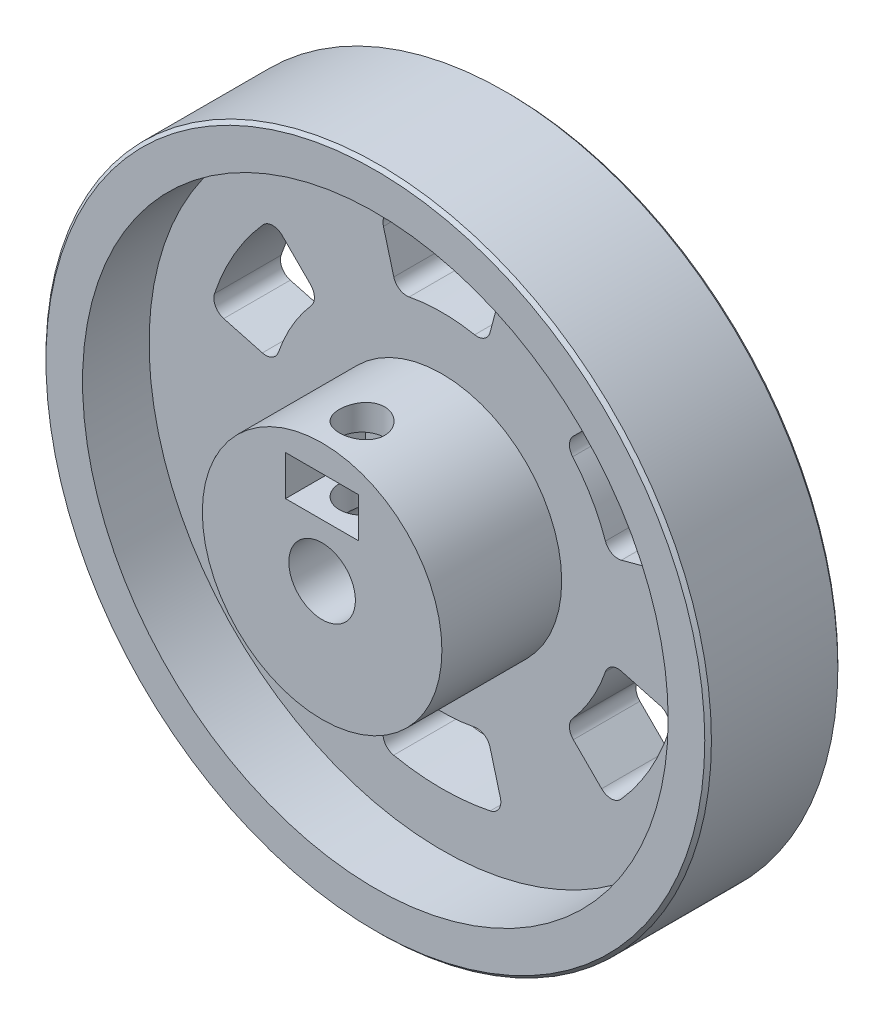
from build123d import *

# Parameters (mm, degrees)
SKETCH1_R               = 25
BOSS_EXTRUDE1_DEPTH     = 5
SKETCH3_R               = 25
SKETCH3_R_2             = 22
BOSS_EXTRUDE3_DEPTH     = 10
SKETCH4_R               = 9
BOSS_EXTRUDE4_DEPTH     = 14
SKETCH5_R               = 2.5
CUT_EXTRUDE1_DEPTH      = 39.026306684
SKETCH6_W               = 5.5
SKETCH6_H               = 3
CUT_EXTRUDE2_DEPTH      = 6
CUT_EXTRUDE3_REACH      = 40.026
CUT_EXTRUDE3_END_RADIUS = 9
SKETCH7_R               = 1.7
CUT_EXTRUDE4_DEPTH      = 39.02630672
CIRPATTERN1_COUNT       = 6
CHAMFER1_SIZE           = 0.25


with BuildPart() as part:
    # Sketch1 → Boss-Extrude1 (new body)
    with BuildSketch(Plane.XY):
        Circle(SKETCH1_R)
    extrude(amount=BOSS_EXTRUDE1_DEPTH)

    # Sketch3 → Boss-Extrude3 (add)
    with BuildSketch(Plane.XY):
        Circle(SKETCH3_R)
        Circle(SKETCH3_R_2, mode=Mode.SUBTRACT)
    extrude(amount=BOSS_EXTRUDE3_DEPTH)

    # Sketch4 → Boss-Extrude4 (add)
    with BuildSketch(Plane.XY):
        Circle(SKETCH4_R)
    extrude(amount=BOSS_EXTRUDE4_DEPTH)

    # Sketch5 → Cut-Extrude1 (cut, through all)
    with BuildSketch(Plane.XY):
        Circle(SKETCH5_R)
    extrude(amount=CUT_EXTRUDE1_DEPTH, mode=Mode.SUBTRACT)

    # Sketch6 → Cut-Extrude2 (cut)
    with BuildSketch(Plane.XY.offset(14)):
        with Locations((0, 5.5)):
            Rectangle(SKETCH6_W, SKETCH6_H)
    extrude(amount=-CUT_EXTRUDE2_DEPTH, mode=Mode.SUBTRACT)

    # Cut-Extrude3: up to this cylinder (the profile starts inside it)
    cut_extrude3_end = Plane(origin=(0, 0, 11), z_dir=(0, 0, -1)) * Cylinder(CUT_EXTRUDE3_END_RADIUS, 99.052, mode=Mode.PRIVATE)
    # Sketch7 → Cut-Extrude3 (cut, up to the surface)
    with BuildSketch(Plane(origin=(0, 0, 0), x_dir=(1, 0, 0), z_dir=(0, 1, 0)), mode=Mode.PRIVATE) as cut_extrude3_sk1:
        with Locations((0, -11)):
            Circle(SKETCH7_R)
    cut_extrude3_tool1 = extrude(cut_extrude3_sk1.sketch, amount=CUT_EXTRUDE3_REACH, mode=Mode.PRIVATE) & cut_extrude3_end
    add(cut_extrude3_tool1.solids().sort_by_distance((0, 0, 11))[0], mode=Mode.SUBTRACT)

    # Sketch8 → Cut-Extrude4 (cut, through all)
    with BuildSketch(Plane.XY):
        with BuildLine():
            Line((-4.392304845, 16.392304845), (-3.614211274, 13.488420103))
            ThreePointArc((-3.614211274, 13.488420103), (-3.178915308, 12.899635496), (-2.459122201, 12.765293494))
            ThreePointArc((-2.459122201, 12.765293494), (0, 13), (2.459122201, 12.765293494))
            ThreePointArc((2.459122201, 12.765293494), (3.178915308, 12.899635496), (3.614211274, 13.488420103))
            Line((3.614211274, 13.488420103), (4.392304845, 16.392304845))
            ThreePointArc((4.392304845, 16.392304845), (4.277317186, 17.176389762), (3.627930726, 17.630601766))
            ThreePointArc((3.627930726, 17.630601766), (0, 18), (-3.627930726, 17.630601766))
            ThreePointArc((-3.627930726, 17.630601766), (-4.277317186, 17.176389762), (-4.392304845, 16.392304845))
        make_face()
    cut_extrude4 = extrude(amount=CUT_EXTRUDE4_DEPTH, mode=Mode.SUBTRACT)

    # CirPattern1: Cut-Extrude4 ×6 about axis
    cirpattern1_axis = Axis((0, 0, 14), (0, 0, 1))
    for i in range(1, CIRPATTERN1_COUNT):
        add(cut_extrude4.rotate(cirpattern1_axis, i * 360 / CIRPATTERN1_COUNT), mode=Mode.SUBTRACT)

    # Chamfer1
    chamfer1_edges = [part.edges().sort_by_distance(p)[0] for p in [
        (-25, 0, 10),
        (-25, 0, 0),
    ]]
    chamfer(chamfer1_edges, length=CHAMFER1_SIZE)


solid = part.part
